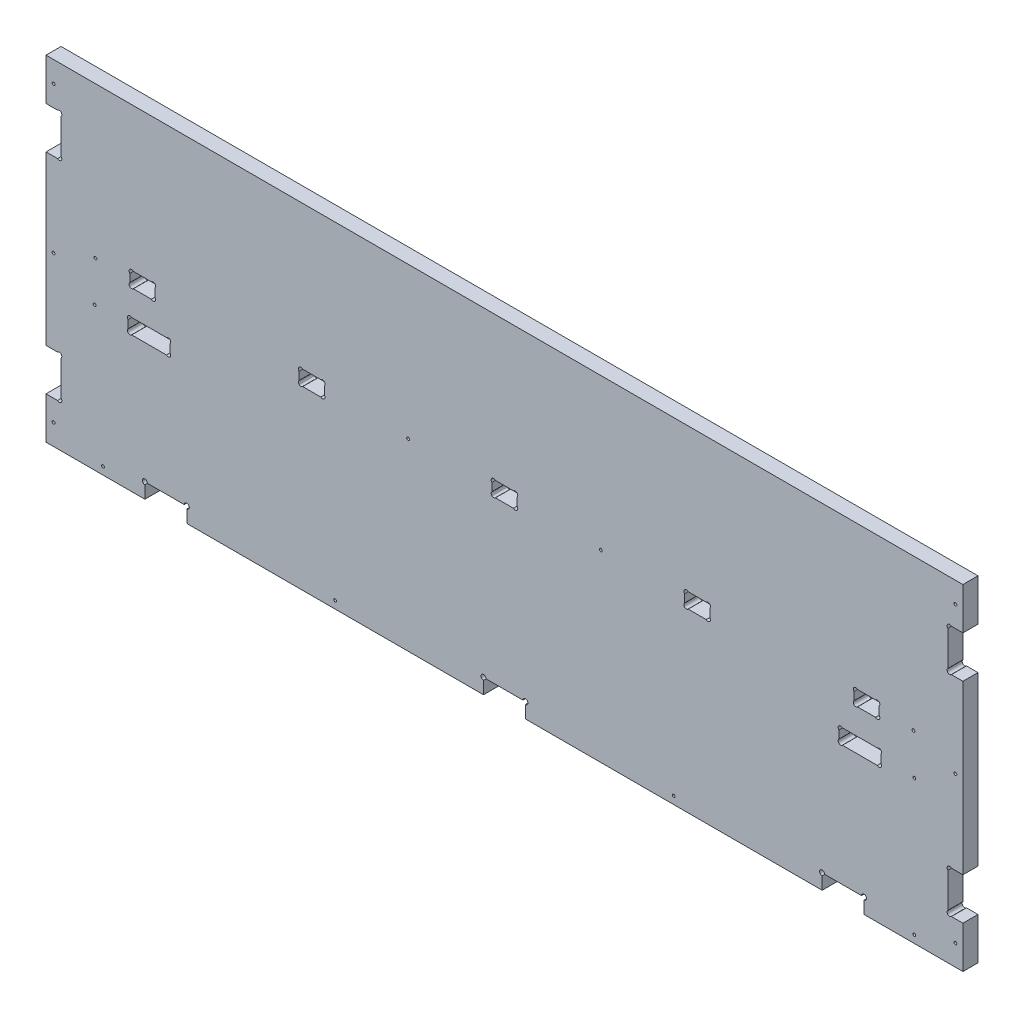
from build123d import *

# Parameters (mm, degrees)
SKETCH1_W            = 1094.236516538
SKETCH1_H            = 400
BOSS_EXTRUDE1_DEPTH  = 18
CAVITY1_START        = -33
CAVITY1_OUTLINE_W    = 18
CAVITY1_OUTLINE_H    = 18
CAVITY1_DEPTH        = 30
CAVITY1_START_2      = 399.118258269
CAVITY1_2_OUTLINE_W  = 18
CAVITY1_2_OUTLINE_H  = 18
CAVITY1_2_DEPTH      = 30
CAVITY1_START_3      = 813.236516538
CAVITY1_3_OUTLINE_W  = 18
CAVITY1_3_OUTLINE_H  = 18
CAVITY1_3_DEPTH      = 30
CAVITY1_START_4      = -15
CAVITY1_4_OUTLINE_W  = 18
CAVITY1_4_OUTLINE_H  = 18
CAVITY1_4_DEPTH      = 50
CAVITY1_START_5      = 831.236516538
CAVITY1_5_OUTLINE_W  = 18
CAVITY1_5_OUTLINE_H  = 18
CAVITY1_5_DEPTH      = 30
CAVITY1_START_6      = 169.118258269
CAVITY1_6_OUTLINE_W  = 18
CAVITY1_6_OUTLINE_H  = 18
CAVITY1_6_DEPTH      = 30
CAVITY1_START_7      = 629.118258269
CAVITY1_7_OUTLINE_W  = 18
CAVITY1_7_OUTLINE_H  = 18
CAVITY1_7_DEPTH      = 30
CAVITY1_START_8      = -35
CAVITY1_8_OUTLINE_W  = 18
CAVITY1_8_OUTLINE_H  = 18
CAVITY1_8_DEPTH      = 50
CAVITY1_START_9      = 389.118258269
CAVITY1_9_OUTLINE_W  = 18
CAVITY1_9_OUTLINE_H  = 18
CAVITY1_9_DEPTH      = 50
CAVITY1_START_10     = 793.236516538
CAVITY1_10_OUTLINE_W = 18
CAVITY1_10_OUTLINE_H = 18
CAVITY1_10_DEPTH     = 20
CAVITY1_START_11     = 861.236516538
CAVITY1_11_OUTLINE_W = 18
CAVITY1_11_OUTLINE_H = 18
CAVITY1_11_DEPTH     = 2
SKETCH2_W            = 18
SKETCH2_H            = 50
CUT_EXTRUDE1_DEPTH   = 18
M3_CLEARANCE_HOLE1_D = 3.4
SKETCH5_R            = 3
CUT_EXTRUDE2_DEPTH   = 30


# Read off the part's stored shape, not the designer's step: Cavity1
with BuildPart() as part:
    # Sketch1 → Boss-Extrude1 (new body)
    with BuildSketch(Plane.XY):
        with Locations((414.118258269, 20)):
            Rectangle(SKETCH1_W, SKETCH1_H)
    extrude(amount=BOSS_EXTRUDE1_DEPTH)

    # Cavity1 outline → Cavity1 (cut)
    with BuildSketch(Plane.YZ.offset(CAVITY1_START)):
        with Locations((-9, 9)):
            Rectangle(CAVITY1_OUTLINE_W, CAVITY1_OUTLINE_H)
        with Locations((39.65, 9)):
            Rectangle(CAVITY1_OUTLINE_W, CAVITY1_OUTLINE_H)
    extrude(amount=CAVITY1_DEPTH, mode=Mode.SUBTRACT)

    # Cavity1 2 outline → Cavity1 2 (cut)
    with BuildSketch(Plane.YZ.offset(CAVITY1_START_2)):
        with Locations((-171, 9)):
            Rectangle(CAVITY1_2_OUTLINE_W, CAVITY1_2_OUTLINE_H)
        with Locations((39.65, 9)):
            Rectangle(CAVITY1_2_OUTLINE_W, CAVITY1_2_OUTLINE_H)
    extrude(amount=CAVITY1_2_DEPTH, mode=Mode.SUBTRACT)

    # Cavity1 3 outline → Cavity1 3 (cut)
    with BuildSketch(Plane.YZ.offset(CAVITY1_START_3)):
        with Locations((-9, 9)):
            Rectangle(CAVITY1_3_OUTLINE_W, CAVITY1_3_OUTLINE_H)
        with Locations((-171, 9)):
            Rectangle(CAVITY1_3_OUTLINE_W, CAVITY1_3_OUTLINE_H)
    extrude(amount=CAVITY1_3_DEPTH, mode=Mode.SUBTRACT)

    # Cavity1 4 outline → Cavity1 4 (cut)
    with BuildSketch(Plane.YZ.offset(CAVITY1_START_4)):
        with Locations((-171, 9)):
            Rectangle(CAVITY1_4_OUTLINE_W, CAVITY1_4_OUTLINE_H)
    extrude(amount=CAVITY1_4_DEPTH, mode=Mode.SUBTRACT)

    # Cavity1 5 outline → Cavity1 5 (cut)
    with BuildSketch(Plane.YZ.offset(CAVITY1_START_5)):
        with Locations((-9, 9)):
            Rectangle(CAVITY1_5_OUTLINE_W, CAVITY1_5_OUTLINE_H)
        with Locations((39.65, 9)):
            Rectangle(CAVITY1_5_OUTLINE_W, CAVITY1_5_OUTLINE_H)
    extrude(amount=CAVITY1_5_DEPTH, mode=Mode.SUBTRACT)

    # Cavity1 6 outline → Cavity1 6 (cut)
    with BuildSketch(Plane.YZ.offset(CAVITY1_START_6)):
        with Locations((39.65, 9)):
            Rectangle(CAVITY1_6_OUTLINE_W, CAVITY1_6_OUTLINE_H)
    extrude(amount=CAVITY1_6_DEPTH, mode=Mode.SUBTRACT)

    # Cavity1 7 outline → Cavity1 7 (cut)
    with BuildSketch(Plane.YZ.offset(CAVITY1_START_7)):
        with Locations((39.65, 9)):
            Rectangle(CAVITY1_7_OUTLINE_W, CAVITY1_7_OUTLINE_H)
    extrude(amount=CAVITY1_7_DEPTH, mode=Mode.SUBTRACT)

    # Cavity1 8 outline → Cavity1 8 (cut)
    with BuildSketch(Plane.YZ.offset(CAVITY1_START_8)):
        with Locations((-9, 9)):
            Rectangle(CAVITY1_8_OUTLINE_W, CAVITY1_8_OUTLINE_H)
    extrude(amount=CAVITY1_8_DEPTH, mode=Mode.SUBTRACT)

    # Cavity1 9 outline → Cavity1 9 (cut)
    with BuildSketch(Plane.YZ.offset(CAVITY1_START_9)):
        with Locations((-171, 9)):
            Rectangle(CAVITY1_9_OUTLINE_W, CAVITY1_9_OUTLINE_H)
    extrude(amount=CAVITY1_9_DEPTH, mode=Mode.SUBTRACT)

    # Cavity1 10 outline → Cavity1 10 (cut)
    with BuildSketch(Plane.YZ.offset(CAVITY1_START_10)):
        with Locations((-171, 9)):
            Rectangle(CAVITY1_10_OUTLINE_W, CAVITY1_10_OUTLINE_H)
    extrude(amount=CAVITY1_10_DEPTH, mode=Mode.SUBTRACT)

    # Cavity1 11 outline → Cavity1 11 (cut)
    with BuildSketch(Plane.YZ.offset(CAVITY1_START_11)):
        with Locations((-9, 9)):
            Rectangle(CAVITY1_11_OUTLINE_W, CAVITY1_11_OUTLINE_H)
    extrude(amount=CAVITY1_11_DEPTH, mode=Mode.SUBTRACT)

    # Sketch2 → Cut-Extrude1 (cut)
    with BuildSketch(Plane.XY.offset(18)):
        with Locations((952.236516538, 145)):
            Rectangle(SKETCH2_W, SKETCH2_H)
        with Locations((952.236516538, -105)):
            Rectangle(SKETCH2_W, SKETCH2_H)
        with Locations((-124, -105)):
            Rectangle(SKETCH2_W, SKETCH2_H)
        with Locations((-124, 145)):
            Rectangle(SKETCH2_W, SKETCH2_H)
    extrude(amount=-CUT_EXTRUDE1_DEPTH, mode=Mode.SUBTRACT)

    # M3 Clearance Hole1 (through all)
    with Locations(Plane.XY.offset(18)):
        with Locations((-65, -171), (212.059129134, -171), (616.177387403, -171), (903.236516538, -171), (952.236516538, -155), (903.236516538, -9), (952.236516538, 20), (902.236516538, 39.65), (952.236516538, 195), (-124, 195), (-124, 20), (-124, -155), (-75, -9), (-74, 39.65), (299.118258269, 39.65), (529.118258269, 39.65)):
            Hole(M3_CLEARANCE_HOLE1_D / 2)

    # Sketch5 → Cut-Extrude2 (cut)
    with BuildSketch(Plane.XY.offset(18)):
        with Locations((-117.121320344, 167.878679656)):
            Circle(SKETCH5_R)
        with Locations((-117.121320344, 122.121320344)):
            Circle(SKETCH5_R)
        with Locations((-30.878679656, 46.528679656)):
            Circle(SKETCH5_R)
        with Locations((-30.878679656, 32.771320344)):
            Circle(SKETCH5_R)
        with Locations((-5.121320344, 32.771320344)):
            Circle(SKETCH5_R)
        with Locations((-5.121320344, 46.528679656)):
            Circle(SKETCH5_R)
        with Locations((-32.878679656, -2.121320344)):
            Circle(SKETCH5_R)
        with Locations((-32.878679656, -15.878679656)):
            Circle(SKETCH5_R)
        with Locations((12.878679656, -15.878679656)):
            Circle(SKETCH5_R)
        with Locations((12.878679656, -2.121320344)):
            Circle(SKETCH5_R)
        with Locations((-117.121320344, -82.121320344)):
            Circle(SKETCH5_R)
        with Locations((-117.121320344, -127.878679656)):
            Circle(SKETCH5_R)
        with Locations((945.357836881, -127.878679656)):
            Circle(SKETCH5_R)
        with Locations((945.357836881, -82.121320344)):
            Circle(SKETCH5_R)
        with Locations((945.357836881, 122.121320344)):
            Circle(SKETCH5_R)
        with Locations((945.357836881, 167.878679656)):
            Circle(SKETCH5_R)
        with Locations((815.357836881, -2.121320344)):
            Circle(SKETCH5_R)
        with Locations((815.357836881, -15.878679656)):
            Circle(SKETCH5_R)
        with Locations((861.115196194, -15.878679656)):
            Circle(SKETCH5_R)
        with Locations((861.115196194, -2.121320344)):
            Circle(SKETCH5_R)
        with Locations((171.241320344, 46.528679656)):
            Circle(SKETCH5_R)
        with Locations((171.241320344, 32.771320344)):
            Circle(SKETCH5_R)
        with Locations((196.998679656, 32.771320344)):
            Circle(SKETCH5_R)
        with Locations((196.998679656, 46.528679656)):
            Circle(SKETCH5_R)
        with Locations((631.237836881, 46.528679656)):
            Circle(SKETCH5_R)
        with Locations((631.237836881, 32.771320344)):
            Circle(SKETCH5_R)
        with Locations((656.995196194, 32.771320344)):
            Circle(SKETCH5_R)
        with Locations((656.995196194, 46.528679656)):
            Circle(SKETCH5_R)
        with Locations((833.357836881, 46.528679656)):
            Circle(SKETCH5_R)
        with Locations((833.357836881, 32.771320344)):
            Circle(SKETCH5_R)
        with Locations((859.115196194, 32.771320344)):
            Circle(SKETCH5_R)
        with Locations((859.115196194, 46.528679656)):
            Circle(SKETCH5_R)
        with Locations((401.241320344, 46.528679656)):
            Circle(SKETCH5_R)
        with Locations((401.241320344, 32.771320344)):
            Circle(SKETCH5_R)
        with Locations((426.998679656, 32.771320344)):
            Circle(SKETCH5_R)
        with Locations((426.998679656, 46.528679656)):
            Circle(SKETCH5_R)
        with Locations((-15, -162)):
            Circle(SKETCH5_R)
        with Locations((35, -162)):
            Circle(SKETCH5_R)
        with Locations((793.236516538, -162)):
            Circle(SKETCH5_R)
        with Locations((843.236516538, -162)):
            Circle(SKETCH5_R)
        with Locations((389.12, -162)):
            Circle(SKETCH5_R)
        with Locations((439.12, -162)):
            Circle(SKETCH5_R)
    extrude(amount=-CUT_EXTRUDE2_DEPTH, mode=Mode.SUBTRACT)


solid = part.part
